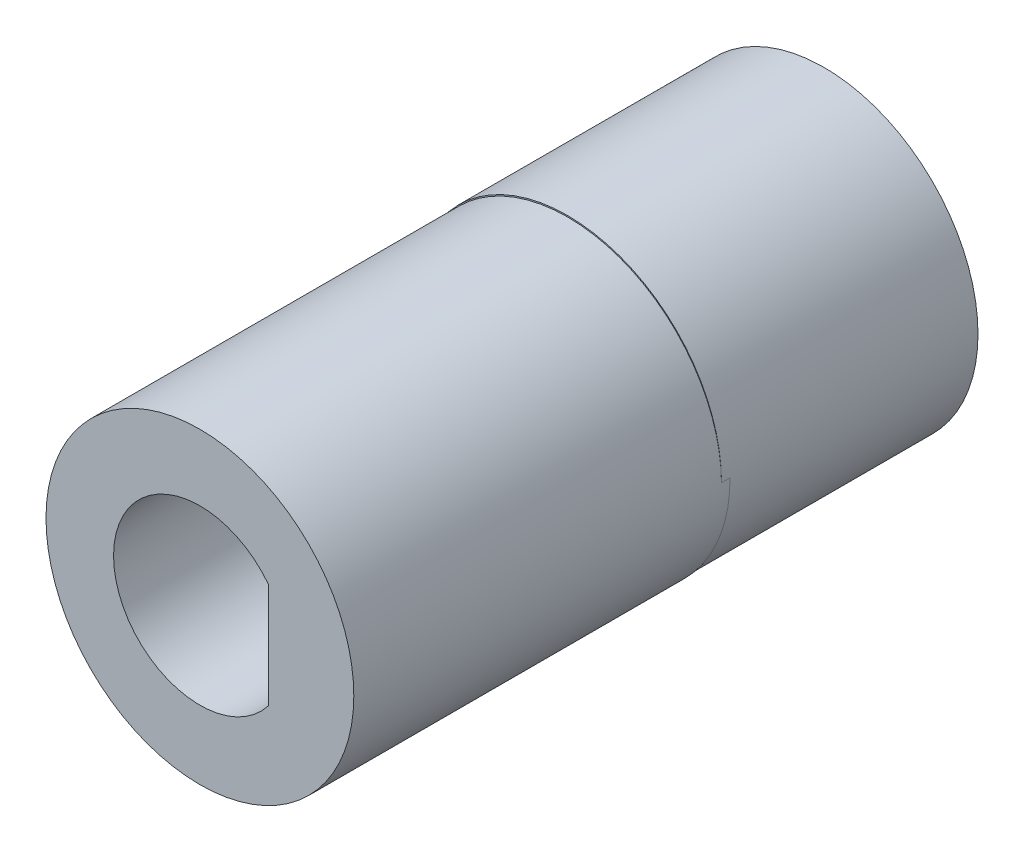
from build123d import *

# Parameters (mm, degrees)
SKETCH1_R           = 9
SKETCH1_R_2         = 3.05
BOSS_EXTRUDE1_DEPTH = 8
BOSS_EXTRUDE2_START = 7
SKETCH1_3_R         = 9
BOSS_EXTRUDE2_DEPTH = 7
SKETCH3_R           = 9
BOSS_EXTRUDE3_DEPTH = 12
SKETCH3_3_R         = 9
BOSS_EXTRUDE4_DEPTH = 10


with BuildPart() as part:
    # Sketch1 → Boss-Extrude1 (new body)
    with BuildSketch(Plane.XY):
        Circle(SKETCH1_R)
        Circle(SKETCH1_R_2, mode=Mode.SUBTRACT)
    extrude(amount=-BOSS_EXTRUDE1_DEPTH)

    # Sketch1<3> → Boss-Extrude2 (add)
    with BuildSketch(Plane.XY.offset(BOSS_EXTRUDE2_START)):
        Circle(SKETCH1_3_R)
        with BuildLine():
            Line((2.5, 1.747140521), (2.5, -1.747140521))
            ThreePointArc((2.5, -1.747140521), (-3.05, 0), (2.5, 1.747140521))
        make_face(mode=Mode.SUBTRACT)
    extrude(amount=-BOSS_EXTRUDE2_DEPTH)



with BuildPart() as body_2:
    # Sketch3 → Boss-Extrude3 (new body)
    with BuildSketch(Plane(origin=(0, 0, 16.5), x_dir=(-1, 0, 0), z_dir=(0, 0, -1))):
        with Locations((0, -0.074857464)):
            Circle(SKETCH3_R)
        with BuildLine():
            Line((-4.000061363, 2.999918181), (-4.000061363, 3.082532902))
            ThreePointArc((-4.000061363, 3.082532902), (5.05, 0), (-4.000061363, -3.082532902))
            Line((-4.000061363, -3.082532902), (-4.000061363, 0))
            Line((-4.000061363, 0), (-4.016547732, 2.977808644))
            ThreePointArc((-4.016547732, 2.977808644), (-4.008319792, 2.98887478), (-4.000061363, 2.999918181))
        make_face(mode=Mode.SUBTRACT)
    extrude(amount=-BOSS_EXTRUDE3_DEPTH)


with BuildPart() as part_1:
    add(part.part)

    add(body_2.part)  # Boss-Extrude4 merges body 2
    # Sketch3<3> → Boss-Extrude4 (add)
    with BuildSketch(Plane(origin=(0, 0, 16.5), x_dir=(-1, 0, 0), z_dir=(0, 0, -1))):
        with Locations((0, -0.074857464)):
            Circle(SKETCH3_3_R)
        with BuildLine():
            ThreePointArc((5.05, 0), (1.62821837, -4.780314314), (-4.000061363, -3.082532902))
            ThreePointArc((-4.000061363, -3.082532902), (-5.05, 0), (-4.000061363, 3.082532902))
            ThreePointArc((-4.000061363, 3.082532902), (1.62821837, 4.780314314), (5.05, 0))
        make_face(mode=Mode.SUBTRACT)
    extrude(amount=BOSS_EXTRUDE4_DEPTH)


solid = part_1.part
